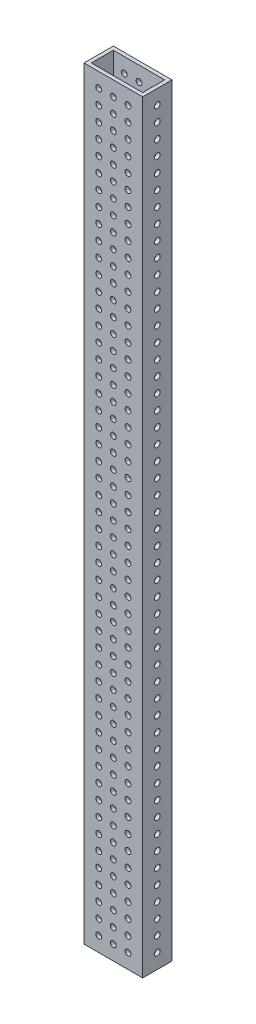
from build123d import *

# Parameters (mm, degrees)
SKETCH1_W            = 50.8
SKETCH1_H            = 25.4
SKETCH1_W_2          = 44.45
SKETCH1_H_2          = 19.05
BOSS_EXTRUDE1_DEPTH  = 330.2
SKETCH2_R            = 2.4892
CUT_EXTRUDE1_DEPTH   = 336.04901134
LPATTERN1_COUNT      = 51
LPATTERN1_PITCH      = 12.7
LPATTERN1_COUNT_DIR2 = 3
LPATTERN1_PITCH_DIR2 = 12.7
SKETCH3_R            = 2.4892
CUT_EXTRUDE2_DEPTH   = 336.04901134
LPATTERN2_COUNT      = 51
LPATTERN2_PITCH      = 12.7


with BuildPart() as part:
    # Sketch1 → Boss-Extrude1 (new, symmetric)
    with BuildSketch(Plane(origin=(0, 0, 0), x_dir=(1, 0, 0), z_dir=(0, 1, 0))):
        with Locations((25.4, 12.7)):
            Rectangle(SKETCH1_W, SKETCH1_H)
        with Locations((25.4, 12.7)):
            Rectangle(SKETCH1_W_2, SKETCH1_H_2, mode=Mode.SUBTRACT)
    extrude(amount=BOSS_EXTRUDE1_DEPTH, both=True)

    # Sketch2 → Cut-Extrude1 (cut, through all)
    with BuildSketch(Plane.XY):
        with Locations((12.7, 317.5)):
            Circle(SKETCH2_R)
    cut_extrude1 = extrude(amount=-CUT_EXTRUDE1_DEPTH, mode=Mode.SUBTRACT)

    # LPattern1: Cut-Extrude1 51 × 3
    with Locations(*[(j * LPATTERN1_PITCH_DIR2, -i * LPATTERN1_PITCH, 0) for i in range(LPATTERN1_COUNT) for j in range(LPATTERN1_COUNT_DIR2) if (i, j) != (0, 0)]):
        add(cut_extrude1, mode=Mode.SUBTRACT)

    # Sketch3 → Cut-Extrude2 (cut, through all)
    with BuildSketch(Plane(origin=(50.8, 0, 0), x_dir=(0, 0, -1), z_dir=(1, 0, 0))):
        with Locations((12.7, 317.5)):
            Circle(SKETCH3_R)
    cut_extrude2 = extrude(amount=-CUT_EXTRUDE2_DEPTH, mode=Mode.SUBTRACT)

    # LPattern2: Cut-Extrude2 ×51
    with Locations(*[(0, -i * LPATTERN2_PITCH, 0) for i in range(1, LPATTERN2_COUNT)]):
        add(cut_extrude2, mode=Mode.SUBTRACT)


solid = part.part
